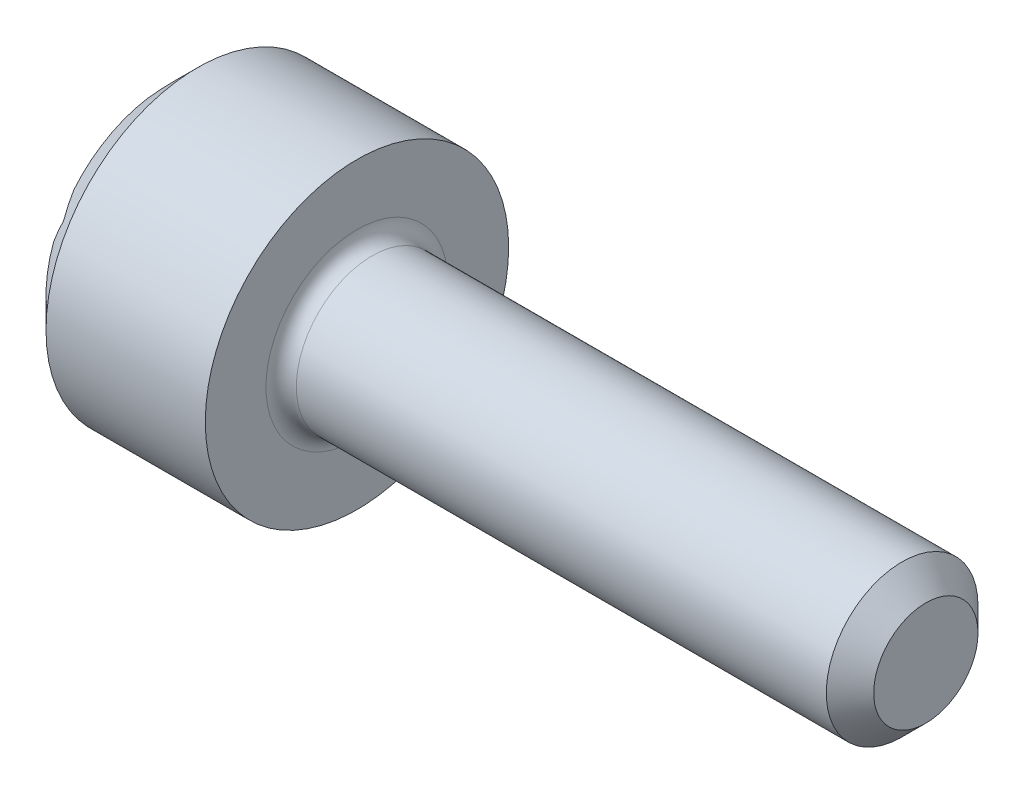
from build123d import *

# Parameters (mm, degrees)
CHAMFER1_SIZE      = 0.625
CUT_EXTRUDE1_DEPTH = 4
CHAMFER2_SIZE      = 0.8
FILLET1_R          = 0.4


with BuildPart() as part:
    # Sketch1 → Revolve1 (revolve)
    with BuildSketch(Plane(origin=(0, 0, 0), x_dir=(1, 0, 0), z_dir=(0, 1, 0))):
        Polygon((0, 0), (0, 4), (5, 4), (5, 2), (20, 2), (20, 0), align=None)
    revolve(axis=Axis((20, 0, 0), (-1, 0, 0)))

    # Chamfer1
    chamfer1_edges = [part.edges().sort_by_distance(p)[0] for p in [
        (20, 0, 2),
    ]]
    chamfer(chamfer1_edges, length=CHAMFER1_SIZE)

    # Sketch3 → Cut-Revolve1 (revolve, cut)
    with BuildSketch(Plane(origin=(0, 0, 0), x_dir=(1, 0, 0), z_dir=(0, 1, 0)), mode=Mode.PRIVATE) as cut_revolve1_sk:
        Polygon((0, 0), (5.732050808, 0), (4, 3), (0, 3), align=None)
    revolve(cut_revolve1_sk.sketch.rotate(Axis((0, 0, 0), (1, 0, 0)), 180), axis=Axis((0, 0, 0), (1, 0, 0)), mode=Mode.SUBTRACT)

    # Sketch2 → Cut-Extrude1 (cut)
    with BuildSketch(Plane.ZY):
        Polygon((0, 3.464101615), (-3, 1.732050808), (-3, -1.732050808), (0, -3.464101615), (3, -1.732050808), (3, 1.732050808), align=None)
    extrude(amount=-CUT_EXTRUDE1_DEPTH, mode=Mode.SUBTRACT)

    # Chamfer2
    # the kernel refuses this chamfer: 0.8 mm, written as the material it takes off along each edge
    with BuildSketch(Plane(origin=(0, 0, 0), x_dir=(0, 0, -1), z_dir=(0, 1, 0))) as chamfer2_piece_1:
        Polygon((4, -CHAMFER2_SIZE), (4 - CHAMFER2_SIZE, 0), (4, 0), align=None)
    revolve(axis=Axis((0, 0, 0), (-1, 0, 0)), mode=Mode.SUBTRACT)

    # Fillet1
    fillet1_edges = [part.edges().sort_by_distance(p)[0] for p in [
        (5, 0, 2),
    ]]
    fillet(fillet1_edges, radius=FILLET1_R)


solid = part.part
